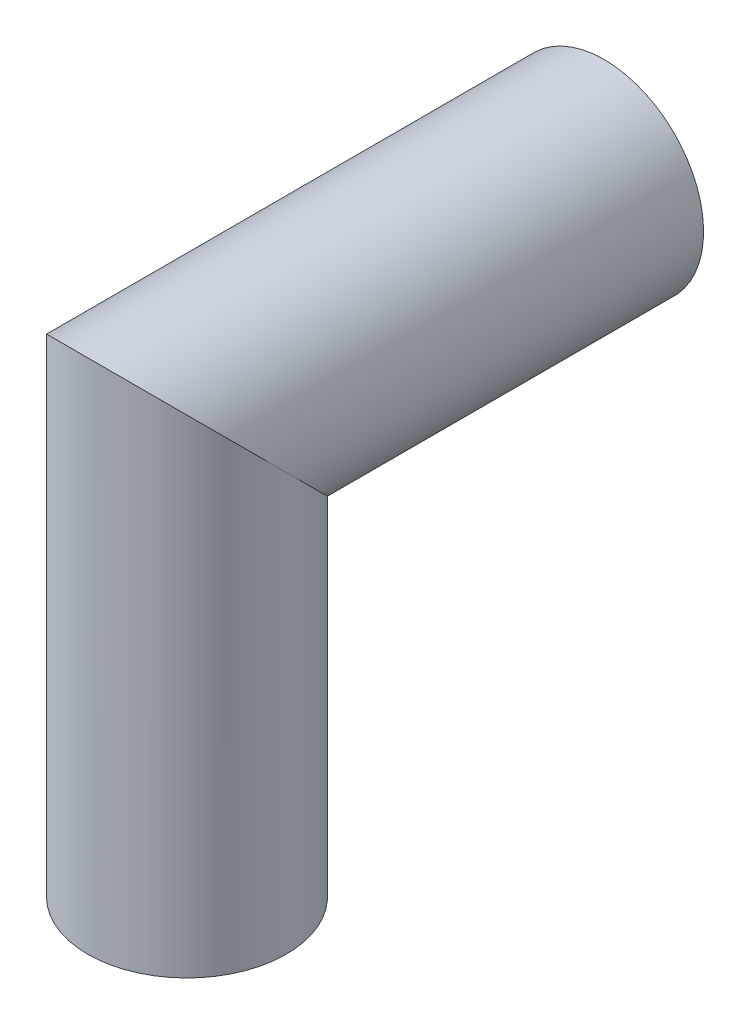
from build123d import *

# Parameters (mm, degrees)
SKETCH2_R   = 4.7625
SKETCH2_R_2 = 3.175


with BuildPart() as part:
    # Sweep2: sweep along a path in Sketch4
    with BuildLine(Plane(origin=(0, 0, 0), x_dir=(0, 0, -1), z_dir=(1, 0, 0))) as sweep2_path:
        Line((8, 0), (8, 20))
        Line((8, 20), (28, 20))
    # Sketch2 → Sweep2 (sweep)
    with BuildSketch(Plane(origin=(0, 0, 0), x_dir=(1, 0, 0), z_dir=(0, 1, 0))):
        with Locations((0, 8)):
            Circle(SKETCH2_R)
        with Locations((0, 8)):
            Circle(SKETCH2_R_2, mode=Mode.SUBTRACT)
    sweep(path=sweep2_path.line, transition=Transition.RIGHT)


solid = part.part
